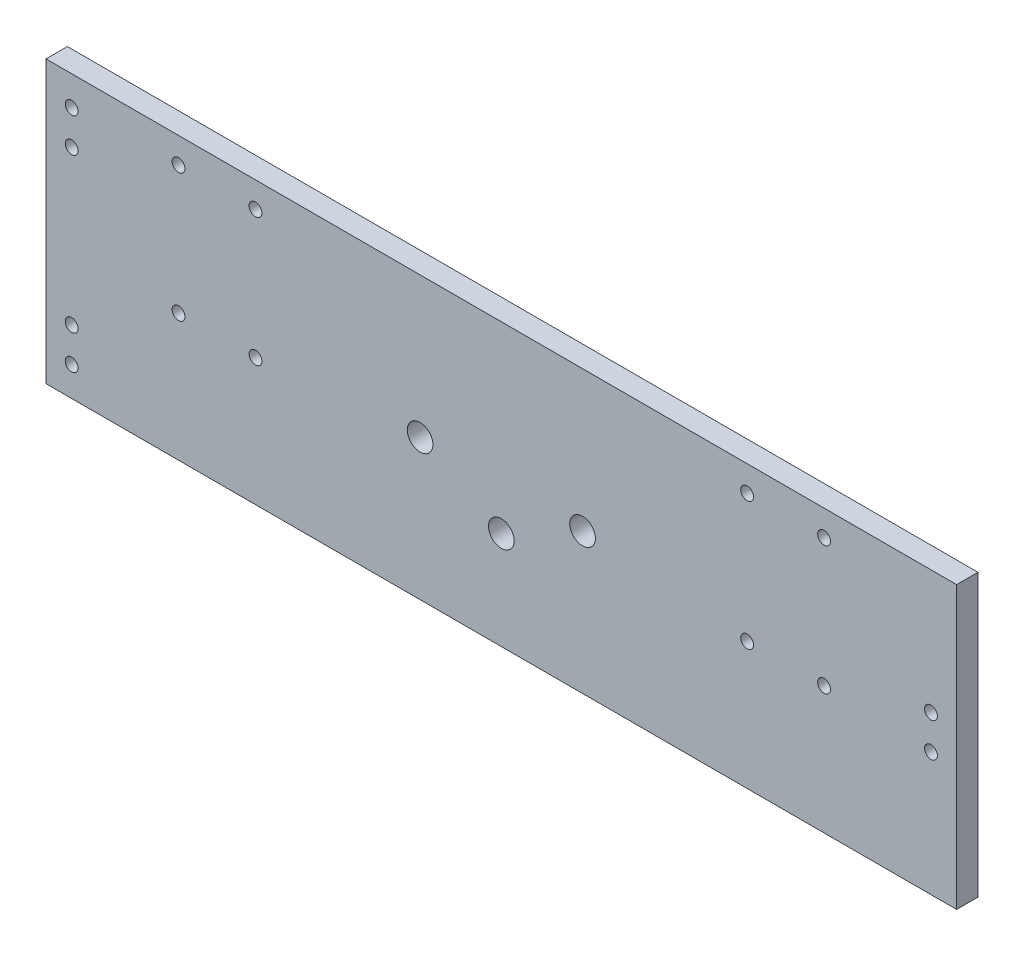
from build123d import *

# Parameters (mm, degrees)
SKETCH_3_W          = 213
SKETCH_3_H          = 65.8
EXTRUDE_2_DEPTH     = 5
SKETCH_4_R          = 1.5
CUT_EXTRUDE_1_DEPTH = 5
SKETCH_5_R          = 1.5
CUT_EXTRUDE_2_DEPTH = 5
SKETCH_6_R          = 3
CUT_EXTRUDE_3_DEPTH = 10


with BuildPart() as part:
    # 草图3 → 凸台-拉伸2 (new body)
    with BuildSketch(Plane.XY):
        Rectangle(SKETCH_3_W, SKETCH_3_H)
    extrude(amount=EXTRUDE_2_DEPTH)

    # 草图4 → 切除-拉伸1 (cut)
    with BuildSketch(Plane.XY.offset(5)):
        with Locations((75.5, 26.9)):
            Circle(SKETCH_4_R)
        with Locations((75.5, -3.1)):
            Circle(SKETCH_4_R)
        with Locations((-75.5, -3.1)):
            Circle(SKETCH_4_R)
        with Locations((-75.5, 26.9)):
            Circle(SKETCH_4_R)
        with Locations((57.5, -3.1)):
            Circle(SKETCH_4_R)
        with Locations((57.5, 26.9)):
            Circle(SKETCH_4_R)
        with Locations((-57.5, -3.1)):
            Circle(SKETCH_4_R)
        with Locations((-57.5, 26.9)):
            Circle(SKETCH_4_R)
    extrude(amount=-CUT_EXTRUDE_1_DEPTH, mode=Mode.SUBTRACT)

    # 草图5 → 切除-拉伸2 (cut)
    with BuildSketch(Plane.XY.offset(5)):
        with Locations((-100.5, 26)):
            Circle(SKETCH_5_R)
        with Locations((-100.5, 18)):
            Circle(SKETCH_5_R)
        with Locations((-100.5, -18)):
            Circle(SKETCH_5_R)
        with Locations((-100.5, -26)):
            Circle(SKETCH_5_R)
        with Locations((100.5, -4)):
            Circle(SKETCH_5_R)
        with Locations((100.5, 4)):
            Circle(SKETCH_5_R)
    extrude(amount=-CUT_EXTRUDE_2_DEPTH, mode=Mode.SUBTRACT)

    # 草图6 → 切除-拉伸3 (cut)
    with BuildSketch(Plane.XY.offset(5)):
        with Locations((19, 0)):
            Circle(SKETCH_6_R)
        with Locations((-19, 0)):
            Circle(SKETCH_6_R)
        with Locations((0, -10)):
            Circle(SKETCH_6_R)
    extrude(amount=-CUT_EXTRUDE_3_DEPTH, mode=Mode.SUBTRACT)


solid = part.part
